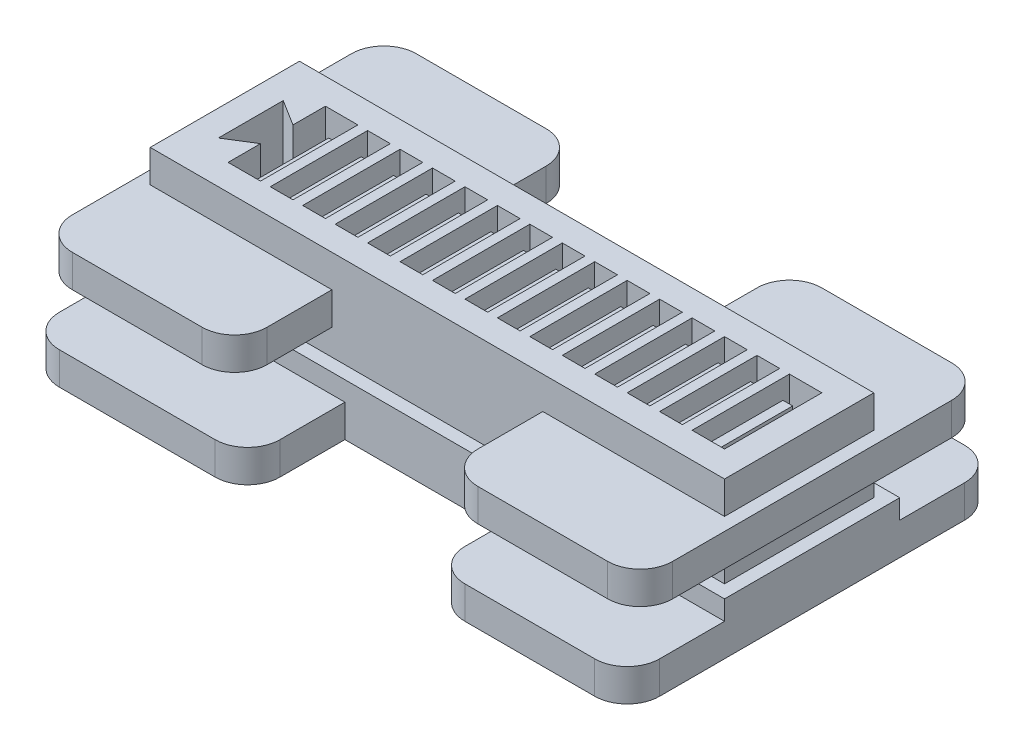
from build123d import *

# Parameters (mm, degrees)
SKETCH1_W            = 3.5
SKETCH1_H            = 15
BOSS_EXTRUDE1_DEPTH  = 15
SKETCH2_W            = 1.5
SKETCH2_H            = 11
CUT_EXTRUDE1_DEPTH   = 13
SKETCH3_W            = 15
SKETCH3_H            = 3
BOSS_EXTRUDE2_DEPTH  = 1.5
LPATTERN1_COUNT      = 15
LPATTERN1_PITCH      = 5
SKETCH4_W            = 15
SKETCH4_H            = 15
BOSS_EXTRUDE3_DEPTH  = 1.5
SKETCH5_W            = 15
SKETCH5_H            = 12
BOSS_EXTRUDE4_DEPTH  = 1.5
SKETCH7_W            = 68.5
SKETCH7_H            = 2
CUT_EXTRUDE2_DEPTH   = 2
SKETCH8_W            = 73.5
SKETCH8_H            = 13
SKETCH8_W_2          = 71.5
SKETCH8_H_2          = 11
BOSS_EXTRUDE5_DEPTH  = 2
SKETCH9_W            = 1.5
SKETCH9_H            = 2.5
BOSS_EXTRUDE6_DEPTH  = 2
LPATTERN2_COUNT      = 14
LPATTERN2_PITCH      = 5
BOSS_EXTRUDE12_DEPTH = 1.5
SKETCH18_R           = 0.75
CUT_EXTRUDE3_DEPTH   = 78.942286341
LPATTERN4_COUNT      = 14
LPATTERN4_PITCH      = 5
BOSS_EXTRUDE13_DEPTH = 20
SKETCH10_W           = 88.5
SKETCH10_H           = 23
BOSS_EXTRUDE7_DEPTH  = 22
SPLIT1_START         = -7
SPLIT1_OUTLINE_W     = 88.5
SPLIT1_OUTLINE_H     = 23
SPLIT1_DEPTH         = 7
SPLIT1_2_OUTLINE_W   = 1.5
SPLIT1_2_OUTLINE_H   = 11
SPLIT1_2_DEPTH       = 13
SPLIT1_3_OUTLINE_W   = 3.5
SPLIT1_3_OUTLINE_H   = 2
SPLIT1_3_DEPTH       = 2
SPLIT1_4_OUTLINE_W   = 88.5
SPLIT1_4_OUTLINE_H   = 23
SPLIT1_4_OUTLINE_W_2 = 73.5
SPLIT1_4_OUTLINE_H_2 = 13
SPLIT1_4_OUTLINE_W_3 = 71.5
SPLIT1_4_OUTLINE_H_3 = 11
SPLIT1_4_OUTLINE_W_4 = 1.5
SPLIT1_4_OUTLINE_H_4 = 2.5
SPLIT1_4_DEPTH       = 7
SPLIT1_5_OUTLINE_W   = 1.5
SPLIT1_5_OUTLINE_H   = 11
SPLIT1_5_DEPTH       = 13
SPLIT1_6_OUTLINE_W   = 73.5
SPLIT1_6_OUTLINE_H   = 13
SPLIT1_6_OUTLINE_W_2 = 71.5
SPLIT1_6_OUTLINE_H_2 = 11
SPLIT1_6_OUTLINE_W_3 = 1.5
SPLIT1_6_OUTLINE_H_3 = 2.5
SPLIT1_6_DEPTH       = 5
SPLIT1_7_OUTLINE_W   = 3.5
SPLIT1_7_OUTLINE_H   = 2
SPLIT1_7_DEPTH       = 2
SPLIT1_8_DEPTH       = 2
SKETCH11_W           = 92.5
SKETCH11_H           = 27
SKETCH11_W_2         = 88.5
SKETCH11_H_2         = 23
BOSS_EXTRUDE8_DEPTH  = 8
SKETCH14_W           = 34
SKETCH14_H           = 15
SKETCH14_W_2         = 30
BOSS_EXTRUDE9_DEPTH  = 5
FILLET1_R            = 5
SKETCH15_W           = 30
SKETCH15_H           = 5
BOSS_EXTRUDE10_DEPTH = 15
FILLET2_R            = 5
FILLET2_OF_MIRROR2_R = 5
BOSS_EXTRUDE11_REACH = 93.575
SKETCH16_W           = 2
SKETCH16_H           = 5


# Read off the part's stored shape, not the designer's step: Split1
with BuildPart() as part:
    # Sketch1 → Boss-Extrude1 (new body)
    with BuildSketch(Plane(origin=(0, 0, 0), x_dir=(1, 0, 0), z_dir=(0, 1, 0))):
        with Locations((1.75, 7.5)):
            Rectangle(SKETCH1_W, SKETCH1_H)
    extrude(amount=BOSS_EXTRUDE1_DEPTH)

    # Sketch2 → Cut-Extrude1 (cut)
    with BuildSketch(Plane.XZ):
        with Locations((1.75, -7.5)):
            Rectangle(SKETCH2_W, SKETCH2_H)
    extrude(amount=-CUT_EXTRUDE1_DEPTH, mode=Mode.SUBTRACT)

    # Sketch3 → Boss-Extrude2 (add)
    with BuildSketch(Plane.ZY):
        with Locations((-7.5, 1.5)):
            Rectangle(SKETCH3_W, SKETCH3_H)
    extrude(amount=BOSS_EXTRUDE2_DEPTH)


with BuildPart() as lpattern1_1:
    # LPattern1: pattern copy
    add(part.part.moved(Location(Vector(1, 0, 0) * (1 * LPATTERN1_PITCH))))


with BuildPart() as lpattern1_2:
    # LPattern1: pattern copy
    add(part.part.moved(Location(Vector(1, 0, 0) * (2 * LPATTERN1_PITCH))))


with BuildPart() as lpattern1_3:
    # LPattern1: pattern copy
    add(part.part.moved(Location(Vector(1, 0, 0) * (3 * LPATTERN1_PITCH))))


with BuildPart() as lpattern1_4:
    # LPattern1: pattern copy
    add(part.part.moved(Location(Vector(1, 0, 0) * (4 * LPATTERN1_PITCH))))


with BuildPart() as lpattern1_5:
    # LPattern1: pattern copy
    add(part.part.moved(Location(Vector(1, 0, 0) * (5 * LPATTERN1_PITCH))))


with BuildPart() as lpattern1_6:
    # LPattern1: pattern copy
    add(part.part.moved(Location(Vector(1, 0, 0) * (6 * LPATTERN1_PITCH))))


with BuildPart() as lpattern1_7:
    # LPattern1: pattern copy
    add(part.part.moved(Location(Vector(1, 0, 0) * (7 * LPATTERN1_PITCH))))


with BuildPart() as lpattern1_8:
    # LPattern1: pattern copy
    add(part.part.moved(Location(Vector(1, 0, 0) * (8 * LPATTERN1_PITCH))))


with BuildPart() as lpattern1_9:
    # LPattern1: pattern copy
    add(part.part.moved(Location(Vector(1, 0, 0) * (9 * LPATTERN1_PITCH))))


with BuildPart() as lpattern1_10:
    # LPattern1: pattern copy
    add(part.part.moved(Location(Vector(1, 0, 0) * (10 * LPATTERN1_PITCH))))


with BuildPart() as lpattern1_11:
    # LPattern1: pattern copy
    add(part.part.moved(Location(Vector(1, 0, 0) * (11 * LPATTERN1_PITCH))))


with BuildPart() as lpattern1_12:
    # LPattern1: pattern copy
    add(part.part.moved(Location(Vector(1, 0, 0) * (12 * LPATTERN1_PITCH))))


with BuildPart() as lpattern1_13:
    # LPattern1: pattern copy
    add(part.part.moved(Location(Vector(1, 0, 0) * (13 * LPATTERN1_PITCH))))


with BuildPart() as lpattern1_14:
    # LPattern1: pattern copy
    add(part.part.moved(Location(Vector(1, 0, 0) * (14 * LPATTERN1_PITCH))))


with BuildPart() as lpattern1_1_1:
    add(lpattern1_1.part)

    # Combine1: union LPattern1_2, LPattern1_3, LPattern1_4, LPattern1_5, LPattern1_6, LPattern1_7, LPattern1_8, LPattern1_9, LPattern1_10, LPattern1_11, LPattern1_12, LPattern1_13, LPattern1_14, part
    add(lpattern1_2.part)
    add(lpattern1_3.part)
    add(lpattern1_4.part)
    add(lpattern1_5.part)
    add(lpattern1_6.part)
    add(lpattern1_7.part)
    add(lpattern1_8.part)
    add(lpattern1_9.part)
    add(lpattern1_10.part)
    add(lpattern1_11.part)
    add(lpattern1_12.part)
    add(lpattern1_13.part)
    add(lpattern1_14.part)
    add(part.part)

    # Sketch4 → Boss-Extrude3 (add)
    with BuildSketch(Plane(origin=(73.5, 0, 0), x_dir=(0, 0, -1), z_dir=(1, 0, 0))):
        with Locations((7.5, 7.5)):
            Rectangle(SKETCH4_W, SKETCH4_H)
    extrude(amount=BOSS_EXTRUDE3_DEPTH)

    # Sketch5 → Boss-Extrude4 (add)
    with BuildSketch(Plane.ZY):
        with Locations((-7.5, 9)):
            Rectangle(SKETCH5_W, SKETCH5_H)
    extrude(amount=BOSS_EXTRUDE4_DEPTH)

    # Sketch7 → Cut-Extrude2 (cut)
    with BuildSketch(Plane.XZ):
        with Locations((36.75, -7.5)):
            Rectangle(SKETCH7_W, SKETCH7_H)
    extrude(amount=-CUT_EXTRUDE2_DEPTH, mode=Mode.SUBTRACT)

    # Sketch8 → Boss-Extrude5 (add)
    with BuildSketch(Plane(origin=(0, 0, 0), x_dir=(-1, 0, 0), z_dir=(0, -1, 0))):
        with Locations((-36.75, 7.5)):
            Rectangle(SKETCH8_W, SKETCH8_H)
        with Locations((-36.75, 7.5)):
            Rectangle(SKETCH8_W_2, SKETCH8_H_2, mode=Mode.SUBTRACT)
    extrude(amount=BOSS_EXTRUDE5_DEPTH)

    # Sketch9 → Boss-Extrude6 (add)
    with BuildSketch(Plane.XZ):
        with Locations((4.25, -4.25)):
            Rectangle(SKETCH9_W, SKETCH9_H)
        with Locations((4.25, -10.75)):
            Rectangle(SKETCH9_W, SKETCH9_H)
    boss_extrude6 = extrude(amount=BOSS_EXTRUDE6_DEPTH)

    # LPattern2: Boss-Extrude6 ×14
    with Locations(*[(i * LPATTERN2_PITCH, 0, 0) for i in range(1, LPATTERN2_COUNT)]):
        add(boss_extrude6)

    # Sketch17 → Boss-Extrude12 (add)
    with BuildSketch(Plane.ZY.offset(-70)):
        Polygon((-15, 11), (-14.25, 11), (-13.5, 3), (-15, 3), align=None)
        Polygon((0, 3), (0, 11), (-0.75, 11), (-1.5, 3), align=None)
    boss_extrude12 = extrude(amount=BOSS_EXTRUDE12_DEPTH)

    # Sketch18 → Cut-Extrude3 (cut, through all)
    with BuildSketch(Plane(origin=(0, 0, -15), x_dir=(-1, 0, 0), z_dir=(0, 0, -1))):
        with Locations((-69.25, 11)):
            Circle(SKETCH18_R)
    cut_extrude3 = extrude(amount=-CUT_EXTRUDE3_DEPTH, mode=Mode.SUBTRACT)

    # LPattern4: Boss-Extrude12, Cut-Extrude3 ×14
    with Locations(*[(-i * LPATTERN4_PITCH, 0, 0) for i in range(1, LPATTERN4_COUNT)]):
        add(boss_extrude12)
        add(cut_extrude3, mode=Mode.SUBTRACT)

    # Sketch19 → Boss-Extrude13 (add)
    with BuildSketch(Plane(origin=(0, 15, 0), x_dir=(1, 0, 0), z_dir=(0, 1, 0))):
        Polygon((-1.5, 5), (-5.5, 2.5), (-5.5, 12.5), (-1.5, 10), align=None)
    extrude(amount=-BOSS_EXTRUDE13_DEPTH)


with BuildPart() as body_2:
    # Sketch10 → Boss-Extrude7 (new body)
    with BuildSketch(Plane(origin=(0, 15, 0), x_dir=(1, 0, 0), z_dir=(0, 1, 0))):
        with Locations((34.75, 7.5)):
            Rectangle(SKETCH10_W, SKETCH10_H)
    extrude(amount=-BOSS_EXTRUDE7_DEPTH)

    # Combine2: cut LPattern1_1
    add(lpattern1_1_1.part, mode=Mode.SUBTRACT)

    # Split1 outline → Split1 (cut)
    with BuildSketch(Plane(origin=(0, 0, 0), x_dir=(1, 0, 0), z_dir=(0, 1, 0)).offset(SPLIT1_START)):
        with Locations((34.75, 7.5)):
            Rectangle(SPLIT1_OUTLINE_W, SPLIT1_OUTLINE_H)
    extrude(amount=SPLIT1_DEPTH, mode=Mode.SUBTRACT)

    # Split1 2 outline → Split1 2 (cut)
    with BuildSketch(Plane(origin=(0, 0, 0), x_dir=(1, 0, 0), z_dir=(0, 1, 0))):
        with Locations((71.75, 7.5)):
            Rectangle(SPLIT1_2_OUTLINE_W, SPLIT1_2_OUTLINE_H)
        with Locations((66.75, 7.5)):
            Rectangle(SPLIT1_2_OUTLINE_W, SPLIT1_2_OUTLINE_H)
        with Locations((61.75, 7.5)):
            Rectangle(SPLIT1_2_OUTLINE_W, SPLIT1_2_OUTLINE_H)
        with Locations((56.75, 7.5)):
            Rectangle(SPLIT1_2_OUTLINE_W, SPLIT1_2_OUTLINE_H)
        with Locations((51.75, 7.5)):
            Rectangle(SPLIT1_2_OUTLINE_W, SPLIT1_2_OUTLINE_H)
        with Locations((46.75, 7.5)):
            Rectangle(SPLIT1_2_OUTLINE_W, SPLIT1_2_OUTLINE_H)
        with Locations((41.75, 7.5)):
            Rectangle(SPLIT1_2_OUTLINE_W, SPLIT1_2_OUTLINE_H)
        with Locations((36.75, 7.5)):
            Rectangle(SPLIT1_2_OUTLINE_W, SPLIT1_2_OUTLINE_H)
        with Locations((31.75, 7.5)):
            Rectangle(SPLIT1_2_OUTLINE_W, SPLIT1_2_OUTLINE_H)
        with Locations((26.75, 7.5)):
            Rectangle(SPLIT1_2_OUTLINE_W, SPLIT1_2_OUTLINE_H)
        with Locations((21.75, 7.5)):
            Rectangle(SPLIT1_2_OUTLINE_W, SPLIT1_2_OUTLINE_H)
        with Locations((16.75, 7.5)):
            Rectangle(SPLIT1_2_OUTLINE_W, SPLIT1_2_OUTLINE_H)
        with Locations((11.75, 7.5)):
            Rectangle(SPLIT1_2_OUTLINE_W, SPLIT1_2_OUTLINE_H)
        with Locations((6.75, 7.5)):
            Rectangle(SPLIT1_2_OUTLINE_W, SPLIT1_2_OUTLINE_H)
        with Locations((1.75, 7.5)):
            Rectangle(SPLIT1_2_OUTLINE_W, SPLIT1_2_OUTLINE_H)
    extrude(amount=SPLIT1_2_DEPTH, mode=Mode.SUBTRACT)

    # Split1 3 outline → Split1 3 (cut)
    with BuildSketch(Plane(origin=(0, 0, 0), x_dir=(1, 0, 0), z_dir=(0, 1, 0))):
        with Locations((69.25, 7.5)):
            Rectangle(SPLIT1_3_OUTLINE_W, SPLIT1_3_OUTLINE_H)
        with Locations((64.25, 7.5)):
            Rectangle(SPLIT1_3_OUTLINE_W, SPLIT1_3_OUTLINE_H)
        with Locations((59.25, 7.5)):
            Rectangle(SPLIT1_3_OUTLINE_W, SPLIT1_3_OUTLINE_H)
        with Locations((54.25, 7.5)):
            Rectangle(SPLIT1_3_OUTLINE_W, SPLIT1_3_OUTLINE_H)
        with Locations((49.25, 7.5)):
            Rectangle(SPLIT1_3_OUTLINE_W, SPLIT1_3_OUTLINE_H)
        with Locations((44.25, 7.5)):
            Rectangle(SPLIT1_3_OUTLINE_W, SPLIT1_3_OUTLINE_H)
        with Locations((39.25, 7.5)):
            Rectangle(SPLIT1_3_OUTLINE_W, SPLIT1_3_OUTLINE_H)
        with Locations((34.25, 7.5)):
            Rectangle(SPLIT1_3_OUTLINE_W, SPLIT1_3_OUTLINE_H)
        with Locations((29.25, 7.5)):
            Rectangle(SPLIT1_3_OUTLINE_W, SPLIT1_3_OUTLINE_H)
        with Locations((24.25, 7.5)):
            Rectangle(SPLIT1_3_OUTLINE_W, SPLIT1_3_OUTLINE_H)
        with Locations((19.25, 7.5)):
            Rectangle(SPLIT1_3_OUTLINE_W, SPLIT1_3_OUTLINE_H)
        with Locations((14.25, 7.5)):
            Rectangle(SPLIT1_3_OUTLINE_W, SPLIT1_3_OUTLINE_H)
        with Locations((9.25, 7.5)):
            Rectangle(SPLIT1_3_OUTLINE_W, SPLIT1_3_OUTLINE_H)
        with Locations((4.25, 7.5)):
            Rectangle(SPLIT1_3_OUTLINE_W, SPLIT1_3_OUTLINE_H)
    extrude(amount=SPLIT1_3_DEPTH, mode=Mode.SUBTRACT)

    # Sketch15 → Boss-Extrude10 (add)
    with BuildSketch(Plane.XY.offset(4)):
        with Locations((3.5, 7.5)):
            Rectangle(SKETCH15_W, SKETCH15_H)
        with Locations((66, 7.5)):
            Rectangle(SKETCH15_W, SKETCH15_H)
    boss_extrude10 = extrude(amount=BOSS_EXTRUDE10_DEPTH)

    # Fillet2
    fillet2_edges = [body_2.edges().sort_by_distance(p)[0] for p in [
        (-11.5, 7.5, 19),
        (18.5, 7.5, 19),
        (51, 7.5, 19),
        (81, 7.5, 19),
    ]]
    fillet(fillet2_edges, radius=FILLET2_R)

    # Mirror2: Boss-Extrude10 across plane
    add(boss_extrude10.mirror(Plane(origin=(0, 0, -7.5), x_dir=(1, 0, 0), z_dir=(0, 0, -1))))

    # Fillet2 of Mirror2
    fillet2_of_mirror2_edges = [body_2.edges().sort_by_distance(p)[0] for p in [
        (-11.5, 7.5, -34),
        (18.5, 7.5, -34),
        (51, 7.5, -34),
        (81, 7.5, -34),
    ]]
    fillet(fillet2_of_mirror2_edges, radius=FILLET2_OF_MIRROR2_R)

    # Sketch16 → Boss-Extrude11 (add, up to next)
    with BuildSketch(Plane(origin=(0, 0, 4), x_dir=(-1, 0, 0), z_dir=(0, 0, -1)), mode=Mode.PRIVATE) as boss_extrude11_sk1:
        with Locations((-80, 7.5)):
            Rectangle(SKETCH16_W, SKETCH16_H)
    boss_extrude11_tool1 = extrude(boss_extrude11_sk1.sketch, amount=BOSS_EXTRUDE11_REACH, mode=Mode.PRIVATE) - body_2.part
    # Sketch16 → Boss-Extrude11 (add, up to next)
    with BuildSketch(Plane(origin=(0, 0, 4), x_dir=(-1, 0, 0), z_dir=(0, 0, -1)), mode=Mode.PRIVATE) as boss_extrude11_sk2:
        with Locations((10.5, 7.5)):
            Rectangle(SKETCH16_W, SKETCH16_H)
    boss_extrude11_tool2 = extrude(boss_extrude11_sk2.sketch, amount=BOSS_EXTRUDE11_REACH, mode=Mode.PRIVATE) - body_2.part
    add(boss_extrude11_tool1.solids().sort_by_distance((80, 7.5, 4))[0])
    add(boss_extrude11_tool2.solids().sort_by_distance((-10.5, 7.5, 4))[0])


with BuildPart() as body_2_2:
    # Split1 4 outline → Split1 4 (new body)
    # profile 1 of 2: a face of its own
    with BuildSketch(Plane(origin=(0, 0, 0), x_dir=(1, 0, 0), z_dir=(0, 1, 0)).offset(SPLIT1_START)):
        with Locations((34.75, 7.5)):
            Rectangle(SPLIT1_4_OUTLINE_W, SPLIT1_4_OUTLINE_H)
        Polygon((-5.5, 12.5), (-1.5, 10), (-1.5, 5), (-5.5, 2.5), align=None, mode=Mode.SUBTRACT)
        with Locations((36.75, 7.5)):
            Rectangle(SPLIT1_4_OUTLINE_W_2, SPLIT1_4_OUTLINE_H_2, mode=Mode.SUBTRACT)
    # profile 2 of 2: a face of its own
    with BuildSketch(Plane(origin=(0, 0, 0), x_dir=(1, 0, 0), z_dir=(0, 1, 0)).offset(SPLIT1_START)):
        with Locations((36.75, 7.5)):
            Rectangle(SPLIT1_4_OUTLINE_W_3, SPLIT1_4_OUTLINE_H_3)
        with Locations((69.25, 4.25)):
            Rectangle(SPLIT1_4_OUTLINE_W_4, SPLIT1_4_OUTLINE_H_4, mode=Mode.SUBTRACT)
        with Locations((69.25, 10.75)):
            Rectangle(SPLIT1_4_OUTLINE_W_4, SPLIT1_4_OUTLINE_H_4, mode=Mode.SUBTRACT)
        with Locations((64.25, 4.25)):
            Rectangle(SPLIT1_4_OUTLINE_W_4, SPLIT1_4_OUTLINE_H_4, mode=Mode.SUBTRACT)
        with Locations((64.25, 10.75)):
            Rectangle(SPLIT1_4_OUTLINE_W_4, SPLIT1_4_OUTLINE_H_4, mode=Mode.SUBTRACT)
        with Locations((59.25, 10.75)):
            Rectangle(SPLIT1_4_OUTLINE_W_4, SPLIT1_4_OUTLINE_H_4, mode=Mode.SUBTRACT)
        with Locations((59.25, 4.25)):
            Rectangle(SPLIT1_4_OUTLINE_W_4, SPLIT1_4_OUTLINE_H_4, mode=Mode.SUBTRACT)
        with Locations((54.25, 10.75)):
            Rectangle(SPLIT1_4_OUTLINE_W_4, SPLIT1_4_OUTLINE_H_4, mode=Mode.SUBTRACT)
        with Locations((54.25, 4.25)):
            Rectangle(SPLIT1_4_OUTLINE_W_4, SPLIT1_4_OUTLINE_H_4, mode=Mode.SUBTRACT)
        with Locations((49.25, 10.75)):
            Rectangle(SPLIT1_4_OUTLINE_W_4, SPLIT1_4_OUTLINE_H_4, mode=Mode.SUBTRACT)
        with Locations((49.25, 4.25)):
            Rectangle(SPLIT1_4_OUTLINE_W_4, SPLIT1_4_OUTLINE_H_4, mode=Mode.SUBTRACT)
        with Locations((44.25, 10.75)):
            Rectangle(SPLIT1_4_OUTLINE_W_4, SPLIT1_4_OUTLINE_H_4, mode=Mode.SUBTRACT)
        with Locations((44.25, 4.25)):
            Rectangle(SPLIT1_4_OUTLINE_W_4, SPLIT1_4_OUTLINE_H_4, mode=Mode.SUBTRACT)
        with Locations((39.25, 10.75)):
            Rectangle(SPLIT1_4_OUTLINE_W_4, SPLIT1_4_OUTLINE_H_4, mode=Mode.SUBTRACT)
        with Locations((39.25, 4.25)):
            Rectangle(SPLIT1_4_OUTLINE_W_4, SPLIT1_4_OUTLINE_H_4, mode=Mode.SUBTRACT)
        with Locations((34.25, 10.75)):
            Rectangle(SPLIT1_4_OUTLINE_W_4, SPLIT1_4_OUTLINE_H_4, mode=Mode.SUBTRACT)
        with Locations((34.25, 4.25)):
            Rectangle(SPLIT1_4_OUTLINE_W_4, SPLIT1_4_OUTLINE_H_4, mode=Mode.SUBTRACT)
        with Locations((29.25, 10.75)):
            Rectangle(SPLIT1_4_OUTLINE_W_4, SPLIT1_4_OUTLINE_H_4, mode=Mode.SUBTRACT)
        with Locations((29.25, 4.25)):
            Rectangle(SPLIT1_4_OUTLINE_W_4, SPLIT1_4_OUTLINE_H_4, mode=Mode.SUBTRACT)
        with Locations((24.25, 10.75)):
            Rectangle(SPLIT1_4_OUTLINE_W_4, SPLIT1_4_OUTLINE_H_4, mode=Mode.SUBTRACT)
        with Locations((24.25, 4.25)):
            Rectangle(SPLIT1_4_OUTLINE_W_4, SPLIT1_4_OUTLINE_H_4, mode=Mode.SUBTRACT)
        with Locations((19.25, 10.75)):
            Rectangle(SPLIT1_4_OUTLINE_W_4, SPLIT1_4_OUTLINE_H_4, mode=Mode.SUBTRACT)
        with Locations((19.25, 4.25)):
            Rectangle(SPLIT1_4_OUTLINE_W_4, SPLIT1_4_OUTLINE_H_4, mode=Mode.SUBTRACT)
        with Locations((14.25, 10.75)):
            Rectangle(SPLIT1_4_OUTLINE_W_4, SPLIT1_4_OUTLINE_H_4, mode=Mode.SUBTRACT)
        with Locations((14.25, 4.25)):
            Rectangle(SPLIT1_4_OUTLINE_W_4, SPLIT1_4_OUTLINE_H_4, mode=Mode.SUBTRACT)
        with Locations((9.25, 10.75)):
            Rectangle(SPLIT1_4_OUTLINE_W_4, SPLIT1_4_OUTLINE_H_4, mode=Mode.SUBTRACT)
        with Locations((9.25, 4.25)):
            Rectangle(SPLIT1_4_OUTLINE_W_4, SPLIT1_4_OUTLINE_H_4, mode=Mode.SUBTRACT)
        with Locations((4.25, 10.75)):
            Rectangle(SPLIT1_4_OUTLINE_W_4, SPLIT1_4_OUTLINE_H_4, mode=Mode.SUBTRACT)
        with Locations((4.25, 4.25)):
            Rectangle(SPLIT1_4_OUTLINE_W_4, SPLIT1_4_OUTLINE_H_4, mode=Mode.SUBTRACT)
    extrude(amount=SPLIT1_4_DEPTH)

    # Split1 5 outline → Split1 5 (add)
    with BuildSketch(Plane(origin=(0, 0, 0), x_dir=(1, 0, 0), z_dir=(0, 1, 0))):
        with Locations((71.75, 7.5)):
            Rectangle(SPLIT1_5_OUTLINE_W, SPLIT1_5_OUTLINE_H)
        with Locations((66.75, 7.5)):
            Rectangle(SPLIT1_5_OUTLINE_W, SPLIT1_5_OUTLINE_H)
        with Locations((61.75, 7.5)):
            Rectangle(SPLIT1_5_OUTLINE_W, SPLIT1_5_OUTLINE_H)
        with Locations((56.75, 7.5)):
            Rectangle(SPLIT1_5_OUTLINE_W, SPLIT1_5_OUTLINE_H)
        with Locations((51.75, 7.5)):
            Rectangle(SPLIT1_5_OUTLINE_W, SPLIT1_5_OUTLINE_H)
        with Locations((46.75, 7.5)):
            Rectangle(SPLIT1_5_OUTLINE_W, SPLIT1_5_OUTLINE_H)
        with Locations((41.75, 7.5)):
            Rectangle(SPLIT1_5_OUTLINE_W, SPLIT1_5_OUTLINE_H)
        with Locations((36.75, 7.5)):
            Rectangle(SPLIT1_5_OUTLINE_W, SPLIT1_5_OUTLINE_H)
        with Locations((31.75, 7.5)):
            Rectangle(SPLIT1_5_OUTLINE_W, SPLIT1_5_OUTLINE_H)
        with Locations((26.75, 7.5)):
            Rectangle(SPLIT1_5_OUTLINE_W, SPLIT1_5_OUTLINE_H)
        with Locations((21.75, 7.5)):
            Rectangle(SPLIT1_5_OUTLINE_W, SPLIT1_5_OUTLINE_H)
        with Locations((16.75, 7.5)):
            Rectangle(SPLIT1_5_OUTLINE_W, SPLIT1_5_OUTLINE_H)
        with Locations((11.75, 7.5)):
            Rectangle(SPLIT1_5_OUTLINE_W, SPLIT1_5_OUTLINE_H)
        with Locations((6.75, 7.5)):
            Rectangle(SPLIT1_5_OUTLINE_W, SPLIT1_5_OUTLINE_H)
        with Locations((1.75, 7.5)):
            Rectangle(SPLIT1_5_OUTLINE_W, SPLIT1_5_OUTLINE_H)
    extrude(amount=SPLIT1_5_DEPTH)

    # Split1 6 outline → Split1 6 (add)
    # profile 1 of 29: a face of its own
    with BuildSketch(Plane(origin=(0, 0, 0), x_dir=(1, 0, 0), z_dir=(0, 1, 0)).offset(SPLIT1_START)):
        with Locations((36.75, 7.5)):
            Rectangle(SPLIT1_6_OUTLINE_W, SPLIT1_6_OUTLINE_H)
        with Locations((36.75, 7.5)):
            Rectangle(SPLIT1_6_OUTLINE_W_2, SPLIT1_6_OUTLINE_H_2, mode=Mode.SUBTRACT)
    # profile 2 of 29: a face of its own
    with BuildSketch(Plane(origin=(0, 0, 0), x_dir=(1, 0, 0), z_dir=(0, 1, 0)).offset(SPLIT1_START)):
        with Locations((69.25, 10.75)):
            Rectangle(SPLIT1_6_OUTLINE_W_3, SPLIT1_6_OUTLINE_H_3)
    # profile 3 of 29: a face of its own
    with BuildSketch(Plane(origin=(0, 0, 0), x_dir=(1, 0, 0), z_dir=(0, 1, 0)).offset(SPLIT1_START)):
        with Locations((64.25, 10.75)):
            Rectangle(SPLIT1_6_OUTLINE_W_3, SPLIT1_6_OUTLINE_H_3)
    # profile 4 of 29: a face of its own
    with BuildSketch(Plane(origin=(0, 0, 0), x_dir=(1, 0, 0), z_dir=(0, 1, 0)).offset(SPLIT1_START)):
        with Locations((59.25, 10.75)):
            Rectangle(SPLIT1_6_OUTLINE_W_3, SPLIT1_6_OUTLINE_H_3)
    # profile 5 of 29: a face of its own
    with BuildSketch(Plane(origin=(0, 0, 0), x_dir=(1, 0, 0), z_dir=(0, 1, 0)).offset(SPLIT1_START)):
        with Locations((54.25, 10.75)):
            Rectangle(SPLIT1_6_OUTLINE_W_3, SPLIT1_6_OUTLINE_H_3)
    # profile 6 of 29: a face of its own
    with BuildSketch(Plane(origin=(0, 0, 0), x_dir=(1, 0, 0), z_dir=(0, 1, 0)).offset(SPLIT1_START)):
        with Locations((49.25, 10.75)):
            Rectangle(SPLIT1_6_OUTLINE_W_3, SPLIT1_6_OUTLINE_H_3)
    # profile 7 of 29: a face of its own
    with BuildSketch(Plane(origin=(0, 0, 0), x_dir=(1, 0, 0), z_dir=(0, 1, 0)).offset(SPLIT1_START)):
        with Locations((44.25, 10.75)):
            Rectangle(SPLIT1_6_OUTLINE_W_3, SPLIT1_6_OUTLINE_H_3)
    # profile 8 of 29: a face of its own
    with BuildSketch(Plane(origin=(0, 0, 0), x_dir=(1, 0, 0), z_dir=(0, 1, 0)).offset(SPLIT1_START)):
        with Locations((39.25, 10.75)):
            Rectangle(SPLIT1_6_OUTLINE_W_3, SPLIT1_6_OUTLINE_H_3)
    # profile 9 of 29: a face of its own
    with BuildSketch(Plane(origin=(0, 0, 0), x_dir=(1, 0, 0), z_dir=(0, 1, 0)).offset(SPLIT1_START)):
        with Locations((34.25, 10.75)):
            Rectangle(SPLIT1_6_OUTLINE_W_3, SPLIT1_6_OUTLINE_H_3)
    # profile 10 of 29: a face of its own
    with BuildSketch(Plane(origin=(0, 0, 0), x_dir=(1, 0, 0), z_dir=(0, 1, 0)).offset(SPLIT1_START)):
        with Locations((29.25, 10.75)):
            Rectangle(SPLIT1_6_OUTLINE_W_3, SPLIT1_6_OUTLINE_H_3)
    # profile 11 of 29: a face of its own
    with BuildSketch(Plane(origin=(0, 0, 0), x_dir=(1, 0, 0), z_dir=(0, 1, 0)).offset(SPLIT1_START)):
        with Locations((24.25, 10.75)):
            Rectangle(SPLIT1_6_OUTLINE_W_3, SPLIT1_6_OUTLINE_H_3)
    # profile 12 of 29: a face of its own
    with BuildSketch(Plane(origin=(0, 0, 0), x_dir=(1, 0, 0), z_dir=(0, 1, 0)).offset(SPLIT1_START)):
        with Locations((19.25, 10.75)):
            Rectangle(SPLIT1_6_OUTLINE_W_3, SPLIT1_6_OUTLINE_H_3)
    # profile 13 of 29: a face of its own
    with BuildSketch(Plane(origin=(0, 0, 0), x_dir=(1, 0, 0), z_dir=(0, 1, 0)).offset(SPLIT1_START)):
        with Locations((14.25, 10.75)):
            Rectangle(SPLIT1_6_OUTLINE_W_3, SPLIT1_6_OUTLINE_H_3)
    # profile 14 of 29: a face of its own
    with BuildSketch(Plane(origin=(0, 0, 0), x_dir=(1, 0, 0), z_dir=(0, 1, 0)).offset(SPLIT1_START)):
        with Locations((9.25, 10.75)):
            Rectangle(SPLIT1_6_OUTLINE_W_3, SPLIT1_6_OUTLINE_H_3)
    # profile 15 of 29: a face of its own
    with BuildSketch(Plane(origin=(0, 0, 0), x_dir=(1, 0, 0), z_dir=(0, 1, 0)).offset(SPLIT1_START)):
        with Locations((4.25, 10.75)):
            Rectangle(SPLIT1_6_OUTLINE_W_3, SPLIT1_6_OUTLINE_H_3)
    # profile 16 of 29: a face of its own
    with BuildSketch(Plane(origin=(0, 0, 0), x_dir=(1, 0, 0), z_dir=(0, 1, 0)).offset(SPLIT1_START)):
        with Locations((4.25, 4.25)):
            Rectangle(SPLIT1_6_OUTLINE_W_3, SPLIT1_6_OUTLINE_H_3)
    # profile 17 of 29: a face of its own
    with BuildSketch(Plane(origin=(0, 0, 0), x_dir=(1, 0, 0), z_dir=(0, 1, 0)).offset(SPLIT1_START)):
        with Locations((9.25, 4.25)):
            Rectangle(SPLIT1_6_OUTLINE_W_3, SPLIT1_6_OUTLINE_H_3)
    # profile 18 of 29: a face of its own
    with BuildSketch(Plane(origin=(0, 0, 0), x_dir=(1, 0, 0), z_dir=(0, 1, 0)).offset(SPLIT1_START)):
        with Locations((14.25, 4.25)):
            Rectangle(SPLIT1_6_OUTLINE_W_3, SPLIT1_6_OUTLINE_H_3)
    # profile 19 of 29: a face of its own
    with BuildSketch(Plane(origin=(0, 0, 0), x_dir=(1, 0, 0), z_dir=(0, 1, 0)).offset(SPLIT1_START)):
        with Locations((19.25, 4.25)):
            Rectangle(SPLIT1_6_OUTLINE_W_3, SPLIT1_6_OUTLINE_H_3)
    # profile 20 of 29: a face of its own
    with BuildSketch(Plane(origin=(0, 0, 0), x_dir=(1, 0, 0), z_dir=(0, 1, 0)).offset(SPLIT1_START)):
        with Locations((24.25, 4.25)):
            Rectangle(SPLIT1_6_OUTLINE_W_3, SPLIT1_6_OUTLINE_H_3)
    # profile 21 of 29: a face of its own
    with BuildSketch(Plane(origin=(0, 0, 0), x_dir=(1, 0, 0), z_dir=(0, 1, 0)).offset(SPLIT1_START)):
        with Locations((29.25, 4.25)):
            Rectangle(SPLIT1_6_OUTLINE_W_3, SPLIT1_6_OUTLINE_H_3)
    # profile 22 of 29: a face of its own
    with BuildSketch(Plane(origin=(0, 0, 0), x_dir=(1, 0, 0), z_dir=(0, 1, 0)).offset(SPLIT1_START)):
        with Locations((34.25, 4.25)):
            Rectangle(SPLIT1_6_OUTLINE_W_3, SPLIT1_6_OUTLINE_H_3)
    # profile 23 of 29: a face of its own
    with BuildSketch(Plane(origin=(0, 0, 0), x_dir=(1, 0, 0), z_dir=(0, 1, 0)).offset(SPLIT1_START)):
        with Locations((39.25, 4.25)):
            Rectangle(SPLIT1_6_OUTLINE_W_3, SPLIT1_6_OUTLINE_H_3)
    # profile 24 of 29: a face of its own
    with BuildSketch(Plane(origin=(0, 0, 0), x_dir=(1, 0, 0), z_dir=(0, 1, 0)).offset(SPLIT1_START)):
        with Locations((44.25, 4.25)):
            Rectangle(SPLIT1_6_OUTLINE_W_3, SPLIT1_6_OUTLINE_H_3)
    # profile 25 of 29: a face of its own
    with BuildSketch(Plane(origin=(0, 0, 0), x_dir=(1, 0, 0), z_dir=(0, 1, 0)).offset(SPLIT1_START)):
        with Locations((49.25, 4.25)):
            Rectangle(SPLIT1_6_OUTLINE_W_3, SPLIT1_6_OUTLINE_H_3)
    # profile 26 of 29: a face of its own
    with BuildSketch(Plane(origin=(0, 0, 0), x_dir=(1, 0, 0), z_dir=(0, 1, 0)).offset(SPLIT1_START)):
        with Locations((54.25, 4.25)):
            Rectangle(SPLIT1_6_OUTLINE_W_3, SPLIT1_6_OUTLINE_H_3)
    # profile 27 of 29: a face of its own
    with BuildSketch(Plane(origin=(0, 0, 0), x_dir=(1, 0, 0), z_dir=(0, 1, 0)).offset(SPLIT1_START)):
        with Locations((59.25, 4.25)):
            Rectangle(SPLIT1_6_OUTLINE_W_3, SPLIT1_6_OUTLINE_H_3)
    # profile 28 of 29: a face of its own
    with BuildSketch(Plane(origin=(0, 0, 0), x_dir=(1, 0, 0), z_dir=(0, 1, 0)).offset(SPLIT1_START)):
        with Locations((64.25, 4.25)):
            Rectangle(SPLIT1_6_OUTLINE_W_3, SPLIT1_6_OUTLINE_H_3)
    # profile 29 of 29: a face of its own
    with BuildSketch(Plane(origin=(0, 0, 0), x_dir=(1, 0, 0), z_dir=(0, 1, 0)).offset(SPLIT1_START)):
        with Locations((69.25, 4.25)):
            Rectangle(SPLIT1_6_OUTLINE_W_3, SPLIT1_6_OUTLINE_H_3)
    extrude(amount=SPLIT1_6_DEPTH)

    # Split1 7 outline → Split1 7 (add)
    with BuildSketch(Plane(origin=(0, 0, 0), x_dir=(1, 0, 0), z_dir=(0, 1, 0))):
        with Locations((69.25, 7.5)):
            Rectangle(SPLIT1_7_OUTLINE_W, SPLIT1_7_OUTLINE_H)
        with Locations((64.25, 7.5)):
            Rectangle(SPLIT1_7_OUTLINE_W, SPLIT1_7_OUTLINE_H)
        with Locations((59.25, 7.5)):
            Rectangle(SPLIT1_7_OUTLINE_W, SPLIT1_7_OUTLINE_H)
        with Locations((54.25, 7.5)):
            Rectangle(SPLIT1_7_OUTLINE_W, SPLIT1_7_OUTLINE_H)
        with Locations((49.25, 7.5)):
            Rectangle(SPLIT1_7_OUTLINE_W, SPLIT1_7_OUTLINE_H)
        with Locations((44.25, 7.5)):
            Rectangle(SPLIT1_7_OUTLINE_W, SPLIT1_7_OUTLINE_H)
        with Locations((39.25, 7.5)):
            Rectangle(SPLIT1_7_OUTLINE_W, SPLIT1_7_OUTLINE_H)
        with Locations((34.25, 7.5)):
            Rectangle(SPLIT1_7_OUTLINE_W, SPLIT1_7_OUTLINE_H)
        with Locations((29.25, 7.5)):
            Rectangle(SPLIT1_7_OUTLINE_W, SPLIT1_7_OUTLINE_H)
        with Locations((24.25, 7.5)):
            Rectangle(SPLIT1_7_OUTLINE_W, SPLIT1_7_OUTLINE_H)
        with Locations((19.25, 7.5)):
            Rectangle(SPLIT1_7_OUTLINE_W, SPLIT1_7_OUTLINE_H)
        with Locations((14.25, 7.5)):
            Rectangle(SPLIT1_7_OUTLINE_W, SPLIT1_7_OUTLINE_H)
        with Locations((9.25, 7.5)):
            Rectangle(SPLIT1_7_OUTLINE_W, SPLIT1_7_OUTLINE_H)
        with Locations((4.25, 7.5)):
            Rectangle(SPLIT1_7_OUTLINE_W, SPLIT1_7_OUTLINE_H)
    extrude(amount=SPLIT1_7_DEPTH)

    # Split1 8 outline → Split1 8 (add)
    with BuildSketch(Plane(origin=(0, 0, 0), x_dir=(1, 0, 0), z_dir=(0, 1, 0)).offset(SPLIT1_START)):
        Polygon((-1.5, 5), (-1.5, 10), (-5.5, 12.5), (-5.5, 2.5), align=None)
    extrude(amount=SPLIT1_8_DEPTH)

    # Sketch11 → Boss-Extrude8 (add)
    with BuildSketch(Plane.XZ.offset(7)):
        with Locations((34.75, -7.5)):
            Rectangle(SKETCH11_W, SKETCH11_H)
        with Locations((34.75, -7.5)):
            Rectangle(SKETCH11_W_2, SKETCH11_H_2, mode=Mode.SUBTRACT)
    extrude(amount=-BOSS_EXTRUDE8_DEPTH)

    # Sketch14 → Boss-Extrude9 (add)
    with BuildSketch(Plane.XZ.offset(7)):
        with Locations((5.5, 13.5)):
            Rectangle(SKETCH14_W, SKETCH14_H)
        with Locations((66, 13.5)):
            Rectangle(SKETCH14_W_2, SKETCH14_H)
        with Locations((66, -28.5)):
            Rectangle(SKETCH14_W_2, SKETCH14_H)
        with Locations((5.5, -28.5)):
            Rectangle(SKETCH14_W, SKETCH14_H)
    extrude(amount=-BOSS_EXTRUDE9_DEPTH)

    # Fillet1
    fillet1_edges = [body_2_2.edges().sort_by_distance(p)[0] for p in [
        (-11.5, -4.5, 21),
        (22.5, -4.5, 21),
        (81, -4.5, 21),
        (51, -4.5, 21),
        (81, -4.5, -36),
        (51, -4.5, -36),
        (-11.5, -4.5, -36),
        (22.5, -4.5, -36),
    ]]
    fillet(fillet1_edges, radius=FILLET1_R)


solid = Compound([body_2.part, body_2_2.part])
